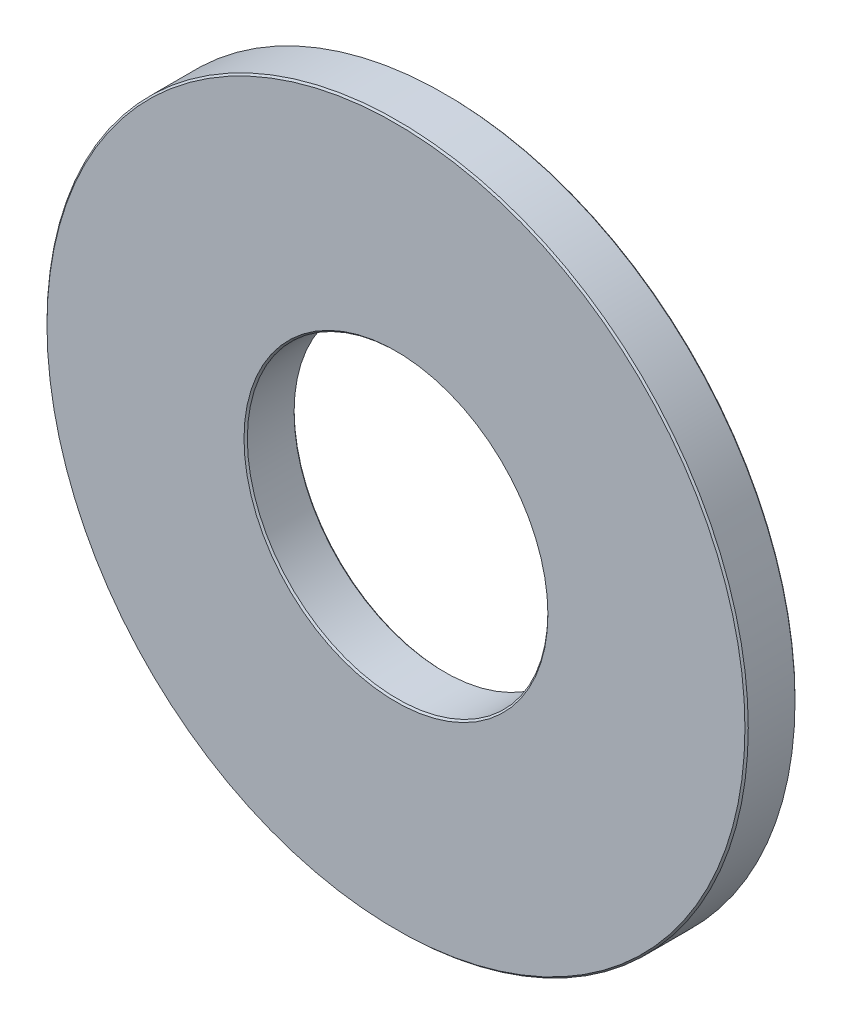
from build123d import *

# Parameters (mm, degrees)
SKETCH1_R          = 5.25
SKETCH1_R_2        = 2.25
BASE_FLANGE1_DEPTH = 0.75
CHAMFER1_SIZE      = 0.025


# Sheet-metal steps are written as plain solids
with BuildPart() as part:
    # Sketch1 → Base-Flange1 (new body)
    with BuildSketch(Plane.XY):
        Circle(SKETCH1_R)
        Circle(SKETCH1_R_2, mode=Mode.SUBTRACT)
    extrude(amount=-BASE_FLANGE1_DEPTH)

    # Chamfer1
    chamfer1_edges = [part.edges().sort_by_distance(p)[0] for p in [
        (-5.25, 0, 0),
        (-5.25, 0, -0.75),
        (-2.25, 0, -0.75),
        (-2.25, 0, 0),
    ]]
    chamfer(chamfer1_edges, length=CHAMFER1_SIZE)


solid = part.part
